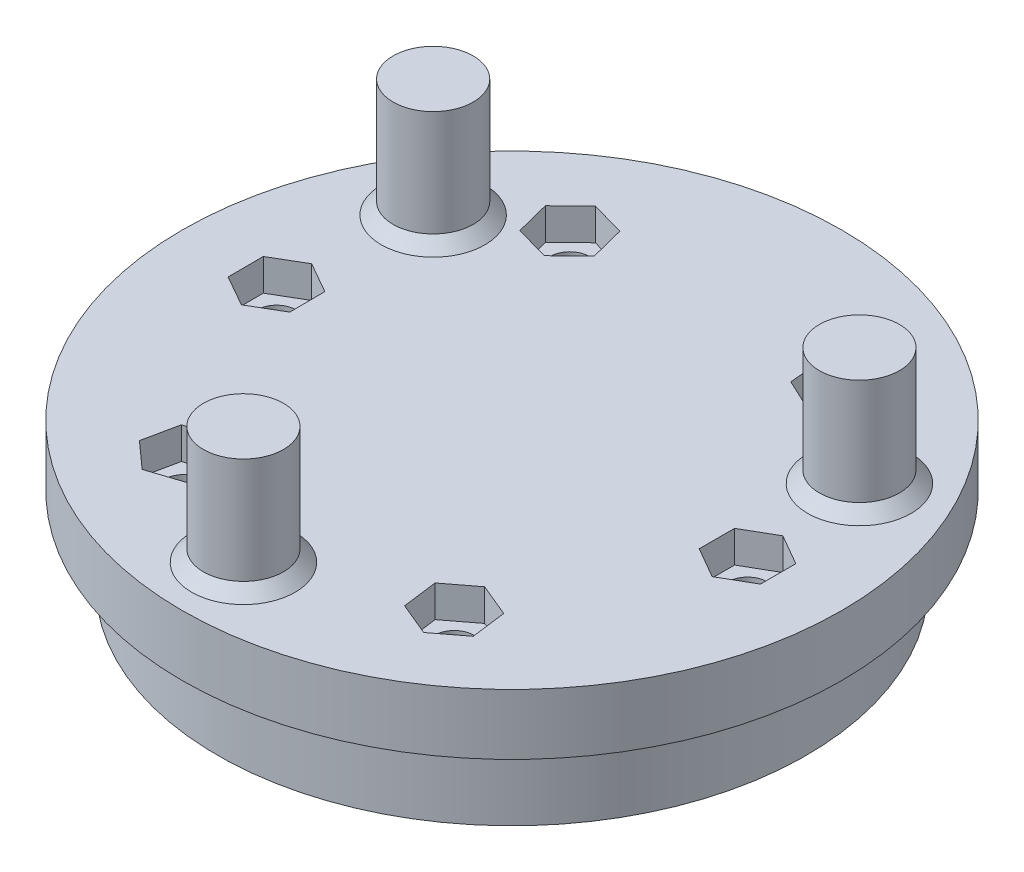
from build123d import *

# Parameters (mm, degrees)
SKETCH3_R               = 28
BOSS_EXTRUDE1_DEPTH     = 5.15
SKETCH6_R               = 25
BOSS_EXTRUDE4_DEPTH     = 7
SKETCH7_R               = 3.4
BOSS_EXTRUDE5_DEPTH     = 10
CUT_EXTRUDE1_DEPTH      = 10
CUT_EXTRUDE1_DEPTH_BACK = 43.3971992
SKETCH8_R               = 1.65
CUT_EXTRUDE3_DEPTH      = 2.7
CHAMFER1_SIZE           = 1


with BuildPart() as part:
    # Sketch3 → Boss-Extrude1 (new body)
    with BuildSketch(Plane(origin=(0, 0, 0), x_dir=(1, 0, 0), z_dir=(0, 1, 0))):
        Circle(SKETCH3_R)
    extrude(amount=BOSS_EXTRUDE1_DEPTH)

    # Sketch6 → Boss-Extrude4 (add)
    with BuildSketch(Plane.XZ):
        Circle(SKETCH6_R)
    extrude(amount=BOSS_EXTRUDE4_DEPTH)

    # Sketch7 → Boss-Extrude5 (add)
    with BuildSketch(Plane(origin=(0, 5.15, 0), x_dir=(1, 0, 0), z_dir=(0, 1, 0))):
        with Locations((-0.954174099, -21.854179847)):
            Circle(SKETCH7_R)
        with Locations((-18.449187877, 11.753428933)):
            Circle(SKETCH7_R)
        with Locations((19.403361976, 10.100750915)):
            Circle(SKETCH7_R)
    extrude(amount=BOSS_EXTRUDE5_DEPTH)

    # Sketch8 → Cut-Extrude1 (cut, two sides: drawn at the far end of the back side and taken through both)
    with BuildSketch(Plane.XZ.offset(-CUT_EXTRUDE1_DEPTH_BACK)):
        with Locations((20, 0)):
            Circle(SKETCH8_R)
        with Locations((-20, 0)):
            Circle(SKETCH8_R)
        with Locations((11.471528727, 16.383040886)):
            Circle(SKETCH8_R)
        with Locations((-11.471528727, -16.383040886)):
            Circle(SKETCH8_R)
        with Locations((11.471528727, -16.383040886)):
            Circle(SKETCH8_R)
        with Locations((-11.471528727, 16.383040886)):
            Circle(SKETCH8_R)
    extrude(amount=CUT_EXTRUDE1_DEPTH + CUT_EXTRUDE1_DEPTH_BACK, mode=Mode.SUBTRACT)

    # Sketch11 → Cut-Extrude3 (cut)
    with BuildSketch(Plane(origin=(0, 5.15, 0), x_dir=(1, 0, 0), z_dir=(0, 1, 0))):
        Polygon((11.858091258, -19.360271603), (14.243167426, -17.536883273), (13.856604896, -14.559652555), (11.084966196, -13.405810169), (8.699890028, -15.229198499), (9.086452558, -18.206429216), align=None)
        Polygon((-12.091418901, -19.320568674), (-9.237500125, -18.388645418), (-8.617609951, -15.45111763), (-10.851638553, -13.445513098), (-13.705557329, -14.377436353), (-14.325447503, -17.314964141), align=None)
        Polygon((-22.590586111, -1.517299224), (-19.981273382, -3.002162995), (-17.390687271, -1.48486377), (-17.409413889, 1.517299224), (-20.018726618, 3.002162995), (-22.609312729, 1.48486377), align=None)
        Polygon((20, -3.0022214), (22.6, -1.5011107), (22.6, 1.5011107), (20, 3.0022214), (17.4, 1.5011107), (17.4, -1.5011107), align=None)
        Polygon((9.008253879, 14.666762832), (11.726231698, 13.391643264), (14.189506546, 15.107921318), (13.934803575, 18.09931894), (11.216825756, 19.374438507), (8.753550908, 17.658160453), align=None)
        Polygon((-10.729703857, 13.473912288), (-8.581237024, 15.57091577), (-9.323061894, 18.480044367), (-12.213353597, 19.292169483), (-14.36182043, 17.195166002), (-13.61999556, 14.286037405), align=None)
    extrude(amount=-CUT_EXTRUDE3_DEPTH, mode=Mode.SUBTRACT)

    # Chamfer1
    chamfer1_edges = [part.edges().sort_by_distance(p)[0] for p in [
        (16.003361976, 5.15, -10.100750915),
        (-21.849187877, 5.15, -11.753428933),
        (-4.354174099, 5.15, 21.854179847),
    ]]
    chamfer(chamfer1_edges, length=CHAMFER1_SIZE)


solid = part.part
